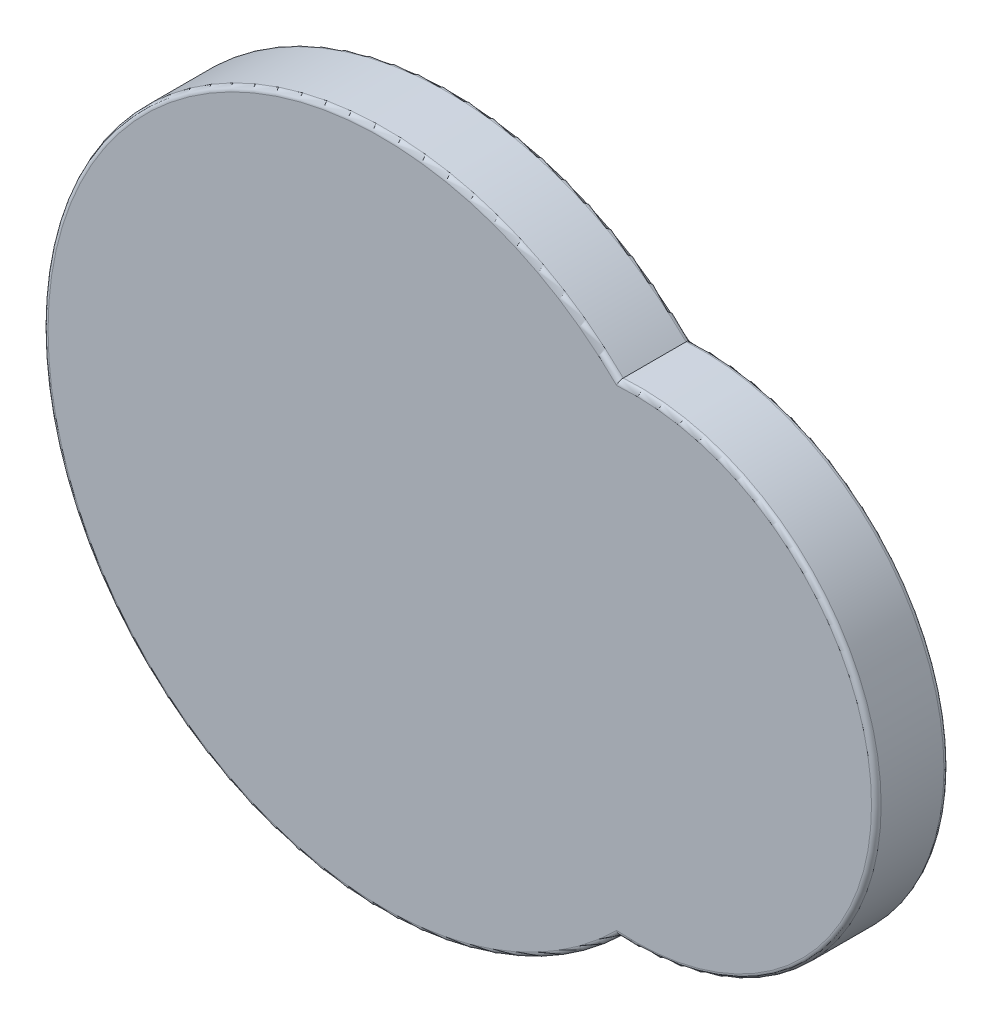
from build123d import *

# Parameters (mm, degrees)
SKETCH_1_R               = 1.75
EXTRUDE_1_DEPTH          = 6.6
EXTRUDE_1_2_DEPTH        = 6.6
SKETCH_2_R               = 50
EXTRUDE_2_DEPTH          = 3.4
SKETCH_4_R               = 1.75
CUT_EXTRUDE_2_DEPTH      = 10
SKETCH_5_R               = 36
EXTRUDE_3_DEPTH          = 4.3
EXTRUDE_4_DEPTH          = 30
SKETCH_9_R               = 10
EXTRUDE_6_DEPTH          = 10
SKETCH_10_R              = 50
CUT_EXTRUDE_4_DEPTH      = 14.3
CUT_EXTRUDE_7_DEPTH      = 20
SKETCH_13_W              = 36
SKETCH_13_H              = 160
CUT_EXTRUDE_8_DEPTH      = 10
SKETCH_14_R              = 3
CUT_EXTRUDE_9_DEPTH      = 10
CUT_EXTRUDE_START        = -10
CUT_EXTRUDE_10_DEPTH     = 10
SKETCH_16_R              = 3
CUT_EXTRUDE_11_DEPTH     = 10
PATTERN_CIRCULAR_1_COUNT = 5
PATTERN_CIRCULAR_1_ANGLE = 180
SKETCH_17_R              = 3
CUT_EXTRUDE_12_DEPTH     = 10
PATTERN_CIRCULAR_2_COUNT = 2
PATTERN_CIRCULAR_2_ANGLE = 45
PATTERN_CIRCULAR_3_COUNT = 2
PATTERN_CIRCULAR_3_ANGLE = 45
FILLET_1_R               = 2


# Read off the part's stored shape, not the designer's step: 切除-拉伸10
with BuildPart() as part:
    # 草图1 → 凸台-拉伸1 (new body)
    with BuildSketch(Plane.XY):
        with BuildLine():
            ThreePointArc((20.506096654, 20.506096654), (29, 0), (20.506096654, -20.506096654))
            Line((20.506096654, -20.506096654), (24.748737342, -24.748737342))
            ThreePointArc((24.748737342, -24.748737342), (24.748737342, -35.355339059), (35.355339059, -35.355339059))
            ThreePointArc((35.355339059, -35.355339059), (50, 0), (35.355339059, 35.355339059))
            ThreePointArc((35.355339059, 35.355339059), (24.748737342, 35.355339059), (24.748737342, 24.748737342))
            Line((24.748737342, 24.748737342), (20.506096654, 20.506096654))
        make_face()
        with Locations((30.0520382, 30.0520382)):
            Circle(SKETCH_1_R, mode=Mode.SUBTRACT)
        with Locations((30.0520382, -30.0520382)):
            Circle(SKETCH_1_R, mode=Mode.SUBTRACT)
        with Locations((42.5, 0)):
            Circle(SKETCH_1_R, mode=Mode.SUBTRACT)
    extrude(amount=EXTRUDE_1_DEPTH)



with BuildPart() as body_2:
    # 草图1 → Extrude 1 2 (new body)
    with BuildSketch(Plane.XY):
        with BuildLine():
            ThreePointArc((-35.355339059, 35.355339059), (-50, 0), (-35.355339059, -35.355339059))
            ThreePointArc((-35.355339059, -35.355339059), (-24.748737342, -35.355339059), (-24.748737342, -24.748737342))
            Line((-24.748737342, -24.748737342), (-20.506096654, -20.506096654))
            ThreePointArc((-20.506096654, -20.506096654), (-29, 0), (-20.506096654, 20.506096654))
            Line((-20.506096654, 20.506096654), (-24.748737342, 24.748737342))
            ThreePointArc((-24.748737342, 24.748737342), (-24.748737342, 35.355339059), (-35.355339059, 35.355339059))
        make_face()
        with Locations((-30.0520382, 30.0520382)):
            Circle(SKETCH_1_R, mode=Mode.SUBTRACT)
        with Locations((-30.0520382, -30.0520382)):
            Circle(SKETCH_1_R, mode=Mode.SUBTRACT)
        with Locations((-42.5, 0)):
            Circle(SKETCH_1_R, mode=Mode.SUBTRACT)
    extrude(amount=EXTRUDE_1_2_DEPTH)


with BuildPart() as part_1:
    add(part.part)

    add(body_2.part)  # 凸台-拉伸2 merges body 2
    # 草图2 → 凸台-拉伸2 (add)
    with BuildSketch(Plane.XY.offset(6.6)):
        with Locations(Location((0, 0, 0), (0, 0, 225))):
            Circle(SKETCH_2_R)
    extrude(amount=EXTRUDE_2_DEPTH)

    # 草图4 → 切除-拉伸2 (cut, symmetric)
    with BuildSketch(Plane(origin=(0, 0, 6.6), x_dir=(-1, 0, 0), z_dir=(0, 0, -1))):
        with Locations(Location((-42.5, 0, 0), (0, 0, 180))):
            Circle(SKETCH_4_R)
        with Locations(Location((-30.0520382, 30.0520382, 0), (0, 0, 180))):
            Circle(SKETCH_4_R)
        with Locations(Location((-30.0520382, -30.0520382, 0), (0, 0, 180))):
            Circle(SKETCH_4_R)
        with Locations(Location((30.0520382, -30.0520382, 0), (0, 0, 180))):
            Circle(SKETCH_4_R)
        with Locations(Location((42.5, 0, 0), (0, 0, 180))):
            Circle(SKETCH_4_R)
        with Locations(Location((30.0520382, 30.0520382, 0), (0, 0, 180))):
            Circle(SKETCH_4_R)
    extrude(amount=CUT_EXTRUDE_2_DEPTH, both=True, mode=Mode.SUBTRACT)

    # 草图5 → 凸台-拉伸3 (add)
    with BuildSketch(Plane.XY.offset(10)):
        with Locations(Location((0, 0, 0), (0, 0, 180))):
            Circle(SKETCH_5_R)
    extrude(amount=EXTRUDE_3_DEPTH)

    # 草图8 → 凸台-拉伸4 (add)
    with BuildSketch(Plane.XY.offset(14.3)):
        with BuildLine():
            ThreePointArc((-6.785714286, -99.769504768), (100, 0), (-6.785714286, 99.769504768))
            ThreePointArc((-6.785714286, 99.769504768), (-245, 0), (-6.785714286, -99.769504768))
        make_face()
    extrude(amount=EXTRUDE_4_DEPTH)

    # 草图9 → 凸台-拉伸6 (add)
    with BuildSketch(Plane(origin=(0, 0, 14.3), x_dir=(-1, 0, 0), z_dir=(0, 0, -1))):
        with Locations(Location((105, 0, 0), (0, 0, 180))):
            Circle(SKETCH_9_R)
    extrude(amount=EXTRUDE_6_DEPTH)

    # 草图10 → 切除-拉伸4 (cut)
    with BuildSketch(Plane(origin=(0, 0, 0), x_dir=(-1, 0, 0), z_dir=(0, 0, -1))):
        Circle(SKETCH_10_R)
    extrude(amount=-CUT_EXTRUDE_4_DEPTH, mode=Mode.SUBTRACT)

    # 草图11 → 切除-拉伸7 (cut)
    with BuildSketch(Plane(origin=(0, 0, 14.3), x_dir=(-1, 0, 0), z_dir=(0, 0, -1))):
        Polygon((-18, -31.176914536), (18, -31.176914536), (36, 0), (18, 31.176914536), (-18, 31.176914536), (-36, 0), align=None)
    extrude(amount=-CUT_EXTRUDE_7_DEPTH, mode=Mode.SUBTRACT)

    # 草图13 → 切除-拉伸8 (cut)
    with BuildSketch(Plane(origin=(0, 0, 14.3), x_dir=(-1, 0, 0), z_dir=(0, 0, -1))):
        Rectangle(SKETCH_13_W, SKETCH_13_H)
    extrude(amount=-CUT_EXTRUDE_8_DEPTH, mode=Mode.SUBTRACT)

    # 草图14 → 切除-拉伸9 (cut)
    with BuildSketch(Plane(origin=(0, 0, 24.3), x_dir=(-1, 0, 0), z_dir=(0, 0, -1))):
        with Locations((0, 62)):
            Circle(SKETCH_14_R)
    cut_extrude_9 = extrude(amount=-CUT_EXTRUDE_9_DEPTH, mode=Mode.SUBTRACT)

    # 镜向1: 切除-拉伸9 across plane
    add(cut_extrude_9.mirror(Plane.ZX), mode=Mode.SUBTRACT)

    # 切除-拉伸10 outline → 切除-拉伸10 (cut)
    with BuildSketch(Plane(origin=(0, 0, 14.3), x_dir=(-1, 0, 0), z_dir=(0, 0, -1)).offset(CUT_EXTRUDE_START)):
        with BuildLine():
            ThreePointArc((213.166538264, 20), (215, 0), (213.166538264, -20.000000001))
            Line((213.166538264, -20.000000001), (215, -20))
            ThreePointArc((215, -20), (235.000000001, 0), (215, 20))
            Line((215, 20), (213.166538264, 20))
        make_face()
        with BuildLine():
            ThreePointArc((167.343157078, 90.627428329), (182.78174593, 77.781745931), (195.627428329, 62.343157079))
            Line((195.627428329, 62.343157079), (196.923881561, 63.63961031))
            ThreePointArc((196.923881561, 63.63961031), (196.923881554, 91.923881558), (168.639610306, 91.923881556))
            Line((168.639610306, 91.923881556), (167.343157078, 90.627428329))
        make_face()
        with BuildLine():
            ThreePointArc((195.627428318, -62.343157094), (182.781745927, -77.781745934), (167.343157087, -90.627428323))
            Line((167.343157087, -90.627428323), (168.639610312, -91.923881548))
            ThreePointArc((168.639610312, -91.923881548), (196.923881525, -91.923881572), (196.923881594, -63.639610359))
            Line((196.923881594, -63.639610359), (195.627428318, -62.343157094))
        make_face()
        with BuildLine():
            ThreePointArc((124.999999989, -108.166538266), (104.999999986, -110), (84.999999984, -108.166538261))
            Line((84.999999984, -108.166538261), (84.999999984, -109.999999998))
            ThreePointArc((84.999999984, -109.999999998), (104.999999924, -130.000000016), (125.000000016, -110.00000015))
            Line((125.000000016, -110.00000015), (124.999999989, -108.166538266))
        make_face()
        with BuildLine():
            ThreePointArc((85.00000001, 108.166538266), (105.000000014, 110), (125.000000017, 108.166538261))
            Line((125.000000017, 108.166538261), (124.999999989, 109.99999985))
            ThreePointArc((124.999999989, 109.99999985), (105.000000076, 129.999999989), (85.000000011, 110.000000002))
            Line((85.000000011, 110.000000002), (85.00000001, 108.166538266))
        make_face()
        with BuildLine():
            Line((-67.082039323, 20), (-70, 20))
            ThreePointArc((-70, 20), (-90, 0), (-70, -20))
            Line((-70, -20), (-67.082039323, -20))
            ThreePointArc((-67.082039323, -20), (-69.999999998, 0), (-67.082039323, 20))
        make_face()
        with BuildLine():
            ThreePointArc((-33.292029197, -61.576300568), (-49.497474649, -49.497474714), (-61.576300524, -33.292029278))
            Line((-61.576300524, -33.292029278), (-63.639610307, -35.355339059))
            ThreePointArc((-63.639610307, -35.355339059), (-63.6396103, -63.639610325), (-35.355339034, -63.639610318))
            Line((-35.355339034, -63.639610318), (-33.292029197, -61.576300568))
        make_face()
        with BuildLine():
            ThreePointArc((-61.576300517, 33.292029292), (-49.497474678, 49.497474685), (-33.292029283, 61.576300521))
            Line((-33.292029283, 61.576300521), (-35.355339063, 63.639610301))
            ThreePointArc((-35.355339063, 63.639610301), (-63.639610303, 63.639610311), (-63.639610293, 35.35533907))
            Line((-63.639610293, 35.35533907), (-61.576300517, 33.292029292))
        make_face()
    extrude(amount=CUT_EXTRUDE_10_DEPTH, mode=Mode.SUBTRACT)

    # 草图16 → 切除-拉伸11 (cut)
    with BuildSketch(Plane(origin=(0, 0, 24.3), x_dir=(-1, 0, 0), z_dir=(0, 0, -1))):
        with Locations((104.999999997, 119.999999989)):
            Circle(SKETCH_16_R)
    cut_extrude_11 = extrude(amount=-CUT_EXTRUDE_11_DEPTH, mode=Mode.SUBTRACT)

    # 阵列(圆周)1: 切除-拉伸11 ×5 about axis
    pattern_circular_1_axis = Axis((-105, 0, 0), (0, 0, 1))
    for i in range(1, PATTERN_CIRCULAR_1_COUNT):
        add(cut_extrude_11.rotate(pattern_circular_1_axis, i * PATTERN_CIRCULAR_1_ANGLE / (PATTERN_CIRCULAR_1_COUNT - 1)), mode=Mode.SUBTRACT)

    # 草图17 → 切除-拉伸12 (cut)
    with BuildSketch(Plane(origin=(0, 0, 24.3), x_dir=(-1, 0, 0), z_dir=(0, 0, -1))):
        with Locations((-80, 0)):
            Circle(SKETCH_17_R)
    cut_extrude_12 = extrude(amount=-CUT_EXTRUDE_12_DEPTH, mode=Mode.SUBTRACT)

    # 阵列(圆周)2: 切除-拉伸12 ×2 about axis
    pattern_circular_2_axis = Axis((0, 0, 34.3), (0, 0, 1))
    for i in range(1, PATTERN_CIRCULAR_2_COUNT):
        add(cut_extrude_12.rotate(pattern_circular_2_axis, i * PATTERN_CIRCULAR_2_ANGLE / (PATTERN_CIRCULAR_2_COUNT - 1)), mode=Mode.SUBTRACT)

    # 阵列(圆周)3: 切除-拉伸12 ×2 about axis
    pattern_circular_3_axis = Axis((0, 0, 34.3), (0, 0, -1))
    for i in range(1, PATTERN_CIRCULAR_3_COUNT):
        add(cut_extrude_12.rotate(pattern_circular_3_axis, i * PATTERN_CIRCULAR_3_ANGLE / (PATTERN_CIRCULAR_3_COUNT - 1)), mode=Mode.SUBTRACT)

    # 圆角1
    fillet_1_edges = [part_1.edges().sort_by_distance(p)[0] for p in [
        (-245, 0, 14.3),
        (100, 0, 14.3),
        (-245, 0, 44.3),
        (100, 0, 44.3),
    ]]
    fillet(fillet_1_edges, radius=FILLET_1_R)


solid = part_1.part
